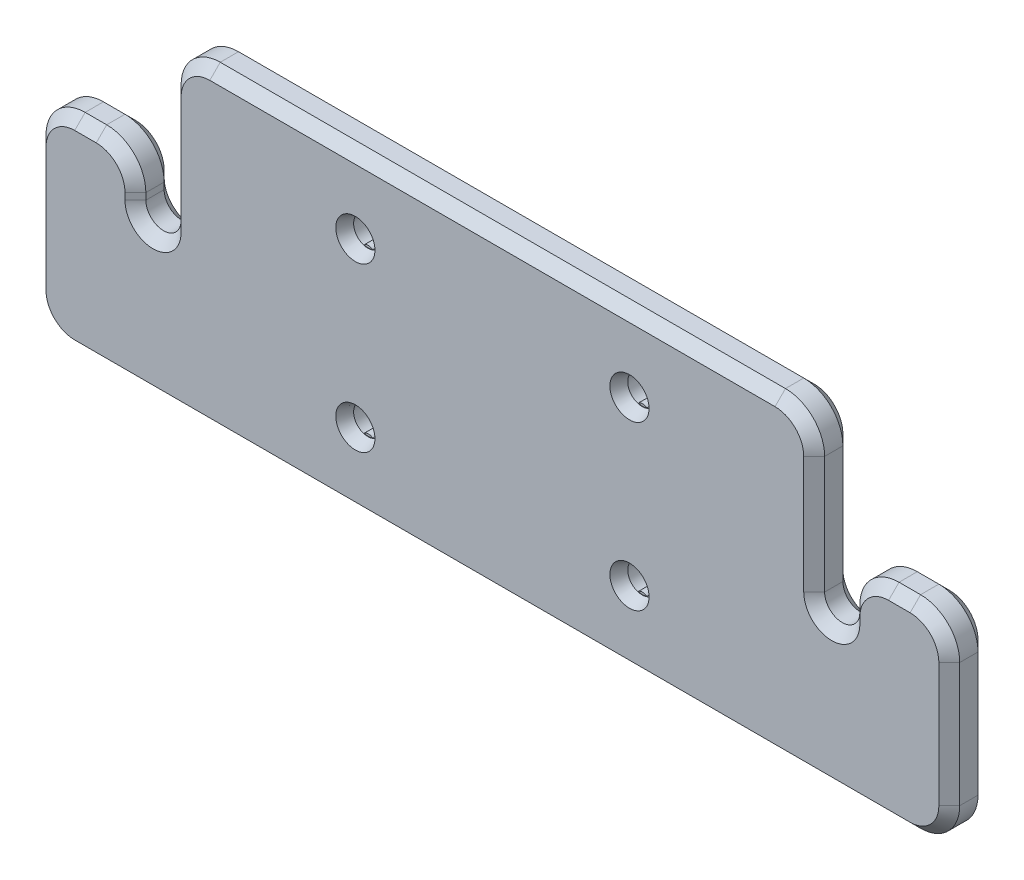
from build123d import *
from OCP.BRepFilletAPI import BRepFilletAPI_MakeChamfer

# Parameters (mm, degrees)
BOSS_EXTRUDE1_DEPTH            = 3
SKETCH4_R                      = 2.3
BOSS_EXTRUDE2_DEPTH            = 2
M2_CLEARANCE_HOLE1_D           = 2.2
M2_CLEARANCE_HOLE1_CSINK_D     = 3
M2_CLEARANCE_HOLE1_CSINK_ANGLE = 45
BOSS_EXTRUDE3_START            = -1
BOSS_EXTRUDE3_DEPTH            = 0.75
CHAMFER1_SIZE                  = 0.4
CHAMFER1_SIZE_2                = 2
CUT_EXTRUDE2_START             = -0.8
CUT_EXTRUDE2_DEPTH             = 0.8
CUT_EXTRUDE3_DEPTH             = 38.336309405
FILLET1_R                      = 3
CHAMFER2_SIZE                  = 0.8


with BuildPart() as part:
    # Sketch1 → Boss-Extrude1 (new body)
    with BuildSketch(Plane.XY):
        with BuildLine():
            Line((32, 12), (-32, 12))
            ThreePointArc((-32, 12), (-34.121320344, 11.121320344), (-35, 9))
            Line((-35, 9), (-35, -9))
            ThreePointArc((-35, -9), (-34.121320344, -11.121320344), (-32, -12))
            Line((-32, -12), (32, -12))
            ThreePointArc((32, -12), (34.121320344, -11.121320344), (35, -9))
            Line((35, -9), (35, 9))
            ThreePointArc((35, 9), (34.121320344, 11.121320344), (32, 12))
        make_face()
    extrude(amount=BOSS_EXTRUDE1_DEPTH)

    # Sketch4 → Boss-Extrude2 (add)
    with BuildSketch(Plane(origin=(0, 0, 0), x_dir=(-1, 0, 0), z_dir=(0, 0, -1))):
        with Locations((-10.5, 6.25)):
            Circle(SKETCH4_R)
        with Locations((10.5, 6.25)):
            Circle(SKETCH4_R)
        with Locations((10.5, -6.25)):
            Circle(SKETCH4_R)
        with Locations((-10.5, -6.25)):
            Circle(SKETCH4_R)
    extrude(amount=BOSS_EXTRUDE2_DEPTH)

    # M2 Clearance Hole1 (through all)
    with Locations(Plane.XY.offset(3)):
        with Locations((10.5, 6.25), (10.5, -6.25), (-10.5, -6.25), (-10.5, 6.25)):
            CounterSinkHole(M2_CLEARANCE_HOLE1_D / 2, M2_CLEARANCE_HOLE1_CSINK_D / 2, counter_sink_angle=M2_CLEARANCE_HOLE1_CSINK_ANGLE)

    # Sketch6 → Boss-Extrude3 (add)
    with BuildSketch(Plane.XY.offset(3).offset(BOSS_EXTRUDE3_START)):
        with BuildLine():
            Line((10.124367201, 5.15), (10.875632799, 5.15))
            ThreePointArc((10.875632799, 5.15), (10.5, 5.32), (10.124367201, 5.15))
        make_face()
        with BuildLine():
            Line((10.124367201, 7.35), (10.875632799, 7.35))
            ThreePointArc((10.875632799, 7.35), (10.5, 7.18), (10.124367201, 7.35))
        make_face()
        with BuildLine():
            Line((-10.124367201, 5.15), (-10.875632799, 5.15))
            ThreePointArc((-10.875632799, 5.15), (-10.5, 5.32), (-10.124367201, 5.15))
        make_face()
        with BuildLine():
            Line((-10.124367201, 7.35), (-10.875632799, 7.35))
            ThreePointArc((-10.875632799, 7.35), (-10.5, 7.18), (-10.124367201, 7.35))
        make_face()
        with BuildLine():
            Line((10.124367201, -7.35), (10.875632799, -7.35))
            ThreePointArc((10.875632799, -7.35), (10.5, -7.18), (10.124367201, -7.35))
        make_face()
        with BuildLine():
            Line((10.124367201, -5.15), (10.875632799, -5.15))
            ThreePointArc((10.875632799, -5.15), (10.5, -5.32), (10.124367201, -5.15))
        make_face()
        with BuildLine():
            Line((-10.124367201, -7.35), (-10.875632799, -7.35))
            ThreePointArc((-10.875632799, -7.35), (-10.5, -7.18), (-10.124367201, -7.35))
        make_face()
        with BuildLine():
            Line((-10.124367201, -5.15), (-10.875632799, -5.15))
            ThreePointArc((-10.875632799, -5.15), (-10.5, -5.32), (-10.124367201, -5.15))
        make_face()
    extrude(amount=-BOSS_EXTRUDE3_DEPTH)

    # Chamfer1
    chamfer1_edges_1 = [part.edges().sort_by_distance(p)[0] for p in [
        (12.8, 6.25, -2),
    ]]
    chamfer1_side_1 = [part.faces().sort_by_distance(p)[0] for p in [
        (12.792, 6.25, -2),
    ]]
    chamfer1_edges_2 = [part.edges().sort_by_distance(p)[0] for p in [
        (-8.2, 6.25, -2),
    ]]
    chamfer1_side_2 = [part.faces().sort_by_distance(p)[0] for p in [
        (-8.208, 6.25, -2),
    ]]
    chamfer1_edges_3 = [part.edges().sort_by_distance(p)[0] for p in [
        (-8.2, -6.25, -2),
    ]]
    chamfer1_side_3 = [part.faces().sort_by_distance(p)[0] for p in [
        (-8.208, -6.25, -2),
    ]]
    chamfer1_edges_4 = [part.edges().sort_by_distance(p)[0] for p in [
        (12.8, -6.25, -2),
    ]]
    chamfer1_side_4 = [part.faces().sort_by_distance(p)[0] for p in [
        (12.792, -6.25, -2),
    ]]
    chamfer1 = BRepFilletAPI_MakeChamfer(part.part.solid().wrapped)
    for e in chamfer1_edges_1:
        chamfer1.Add(CHAMFER1_SIZE - 0.0001, CHAMFER1_SIZE_2 - 0.0001, e.wrapped, chamfer1_side_1[0].wrapped)
    for e in chamfer1_edges_2:
        chamfer1.Add(CHAMFER1_SIZE - 0.0001, CHAMFER1_SIZE_2 - 0.0001, e.wrapped, chamfer1_side_2[0].wrapped)
    for e in chamfer1_edges_3:
        chamfer1.Add(CHAMFER1_SIZE - 0.0001, CHAMFER1_SIZE_2 - 0.0001, e.wrapped, chamfer1_side_3[0].wrapped)
    for e in chamfer1_edges_4:
        chamfer1.Add(CHAMFER1_SIZE - 0.0001, CHAMFER1_SIZE_2 - 0.0001, e.wrapped, chamfer1_side_4[0].wrapped)
    add(Compound.cast(chamfer1.Shape()), mode=Mode.REPLACE)  # a hair under: the kernel refuses the full size

    # Sketch5 → Cut-Extrude2 (cut)
    with BuildSketch(Plane(origin=(0, 0, -2), x_dir=(-1, 0, 0), z_dir=(0, 0, -1)).offset(CUT_EXTRUDE2_START)):
        with BuildLine():
            Line((8.712564289, 7.697436899), (10.5, 6.25))
            Line((10.5, 6.25), (9.180774196, 4.365950298))
            ThreePointArc((9.180774196, 4.365950298), (8.222383442, 5.929901868), (8.712564289, 7.697436899))
        make_face()
        with BuildLine():
            Line((10.419731158, -8.548598902), (10.5, -6.25))
            Line((10.5, -6.25), (8.258948851, -6.767387425))
            ThreePointArc((8.258948851, -6.767387425), (9.037020093, -8.024736542), (10.419731158, -8.548598902))
        make_face()
        with BuildLine():
            Line((-12.674692724, 5.501193245), (-10.5, 6.25))
            Line((-10.5, 6.25), (-10.740415466, 3.962599641))
            ThreePointArc((-10.740415466, 3.962599641), (-11.931783664, 4.450001239), (-12.674692724, 5.501193245))
        make_face()
        with BuildLine():
            Line((-10.5, -3.95), (-10.5, -6.25))
            Line((-10.5, -6.25), (-8.200350301, -6.209859465))
            ThreePointArc((-8.200350301, -6.209859465), (-8.887908692, -4.609523967), (-10.5, -3.95))
        make_face()
    extrude(amount=CUT_EXTRUDE2_DEPTH, mode=Mode.SUBTRACT)

    # Sketch7 → Cut-Extrude3 (cut, through all)
    with BuildSketch(Plane.XY.offset(3)):
        with BuildLine():
            Line((35, 3.5), (27.35, 3.5))
            Line((27.35, 3.5), (27.35, 0))
            ThreePointArc((27.35, 0), (26, -1.35), (24.65, 0))
            Line((24.65, 0), (24.65, 12))
            Line((24.65, 12), (35, 12))
            Line((35, 12), (35, 3.5))
        make_face()
        with BuildLine():
            Line((-35, 12), (-24.65, 12))
            Line((-24.65, 12), (-24.65, 0))
            ThreePointArc((-24.65, 0), (-26, -1.35), (-27.35, 0))
            Line((-27.35, 0), (-27.35, 3.5))
            Line((-27.35, 3.5), (-35, 3.5))
            Line((-35, 3.5), (-35, 12))
        make_face()
    extrude(amount=-CUT_EXTRUDE3_DEPTH, mode=Mode.SUBTRACT)

    # Fillet1
    fillet1_edges = [part.edges().sort_by_distance(p)[0] for p in [
        (24.65, 12, 1.5),
        (35, 3.5, 1.5),
        (27.35, 3.5, 1.5),
        (-35, 3.5, 1.5),
        (-27.35, 3.5, 1.5),
        (-24.65, 12, 1.5),
    ]]
    fillet(fillet1_edges, radius=FILLET1_R)

    # Chamfer2
    chamfer2_edges = [part.edges().sort_by_distance(p)[0] for p in [
        (35, -4.25, 0),
        (34.121320344, -11.121320344, 0),
        (0, -12, 0),
        (-34.121320344, -11.121320344, 0),
        (34.121320344, -11.121320344, 3),
        (35, -4.25, 3),
        (-26, -1.35, 0),
        (-27.35, 0.25, 0),
        (24.65, 4.5, 0),
        (26, -1.35, 0),
        (26, -1.35, 3),
        (27.35, 0.25, 3),
        (-26, -1.35, 3),
        (-24.65, 4.5, 3),
        (-31.175, 3.5, 0),
        (-31.175, 3.5, 3),
        (31.175, 3.5, 3),
        (24.65, 4.5, 3),
        (0, 12, 3),
        (-27.35, 0.25, 3),
        (-35, -4.25, 3),
        (34.121320344, 2.621320344, 3),
        (28.228679656, 2.621320344, 3),
        (23.771320344, 11.121320344, 3),
        (-23.771320344, 11.121320344, 3),
        (-28.228679656, 2.621320344, 3),
        (-34.121320344, 2.621320344, 3),
        (-35, -4.25, 0),
        (31.175, 3.5, 0),
        (-24.65, 4.5, 0),
        (0, 12, 0),
        (27.35, 0.25, 0),
        (34.121320344, 2.621320344, 0),
        (28.228679656, 2.621320344, 0),
        (23.771320344, 11.121320344, 0),
        (-23.771320344, 11.121320344, 0),
        (-28.228679656, 2.621320344, 0),
        (-34.121320344, 2.621320344, 0),
        (-34.121320344, -11.121320344, 3),
        (0, -12, 3),
    ]]
    chamfer(chamfer2_edges, length=CHAMFER2_SIZE)


solid = part.part
